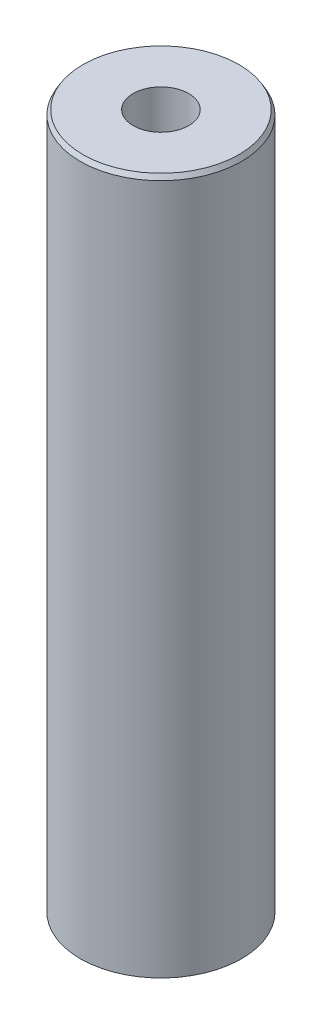
from build123d import *
from OCP.BRepFilletAPI import BRepFilletAPI_MakeChamfer

# Parameters (mm, degrees)
SKETCH1_R           = 52.5
BOSS_EXTRUDE1_DEPTH = 454.084616266
SKETCH2_R           = 18.101191581
CUT_EXTRUDE1_DEPTH  = 461.114484373
CHAMFER1_SIZE       = 2.992513822
CHAMFER1_SIZE2      = 1.727728661


with BuildPart() as part:
    # Sketch1 → Boss-Extrude1 (new body)
    with BuildSketch(Plane(origin=(0, 0, 0), x_dir=(1, 0, 0), z_dir=(0, 1, 0))):
        Circle(SKETCH1_R)
    extrude(amount=BOSS_EXTRUDE1_DEPTH)

    # Sketch2 → Cut-Extrude1 (cut, through all)
    with BuildSketch(Plane(origin=(0, 0, 0), x_dir=(1, 0, 0), z_dir=(0, 1, 0))):
        Circle(SKETCH2_R)
    extrude(amount=CUT_EXTRUDE1_DEPTH, mode=Mode.SUBTRACT)

    # Chamfer1: one chamfer whose edges measure the first distance from different faces: ONE call of the kernel's chamfer builder (chamfer() names one face for all edges)
    chamfer1_edges_1 = [part.edges().sort_by_distance(p)[0] for p in [
        (-52.5, 454.084616266, 0),
    ]]
    chamfer1_side_1 = [part.faces().sort_by_distance(p)[0] for p in [
        (-52.5, 227.042308133, 0),
    ]]
    chamfer1_edges_2 = [part.edges().sort_by_distance(p)[0] for p in [
        (-52.5, 0, 0),
    ]]
    chamfer1_side_2 = [part.faces().sort_by_distance(p)[0] for p in [
        (-51.01507576, 0, 0),
    ]]
    chamfer1 = BRepFilletAPI_MakeChamfer(part.part.solid().wrapped)
    for e in chamfer1_edges_1:
        chamfer1.Add(CHAMFER1_SIZE, CHAMFER1_SIZE2, e.wrapped, chamfer1_side_1[0].wrapped)  # the first distance lies on this face
    for e in chamfer1_edges_2:
        chamfer1.Add(CHAMFER1_SIZE, CHAMFER1_SIZE2, e.wrapped, chamfer1_side_2[0].wrapped)  # the first distance lies on this face
    add(Compound.cast(chamfer1.Shape()), mode=Mode.REPLACE)


solid = part.part
